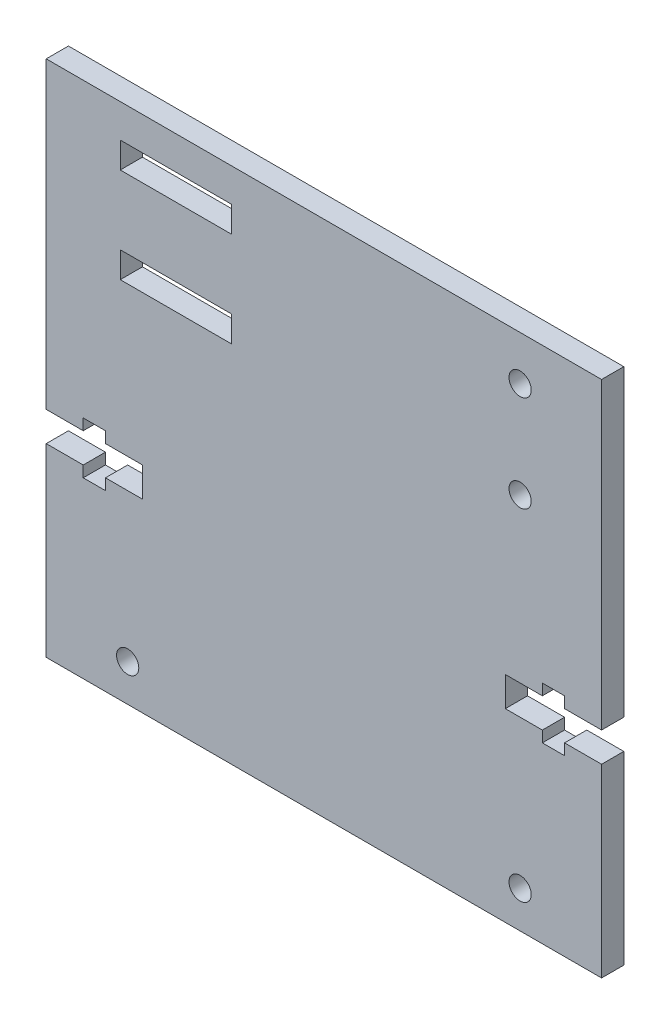
from build123d import *

# Parameters (mm, degrees)
ESQUISSE1_R        = 1.5
ESQUISSE1_W        = 15
ESQUISSE1_H        = 3.5
BOSS_EXTRU_1_DEPTH = 3


with BuildPart() as part:
    # Esquisse1 → Boss.-Extru.1 (new body)
    with BuildSketch(Plane.XY):
        Polygon((0, 25), (0, 0), (75, 0), (75, 25), (70, 25), (70, 23.5), (67, 23.5), (67, 25), (62, 25), (62, 29), (67, 29), (67, 30.5), (70, 30.5), (70, 29), (75, 29), (75, 70), (0, 70), (0, 29), (5, 29), (5, 30.5), (8, 30.5), (8, 29), (13, 29), (13, 25), (8, 25), (8, 23.5), (5, 23.5), (5, 25), align=None)
        with Locations((11, 5)):
            Circle(ESQUISSE1_R, mode=Mode.SUBTRACT)
        with Locations((17.5, 50.921783047)):
            Rectangle(ESQUISSE1_W, ESQUISSE1_H, mode=Mode.SUBTRACT)
        with Locations((17.5, 63.75)):
            Rectangle(ESQUISSE1_W, ESQUISSE1_H, mode=Mode.SUBTRACT)
        with Locations((64, 64)):
            Circle(ESQUISSE1_R, mode=Mode.SUBTRACT)
        with Locations((64, 5)):
            Circle(ESQUISSE1_R, mode=Mode.SUBTRACT)
        with Locations((64, 51)):
            Circle(ESQUISSE1_R, mode=Mode.SUBTRACT)
    extrude(amount=BOSS_EXTRU_1_DEPTH)


solid = part.part
